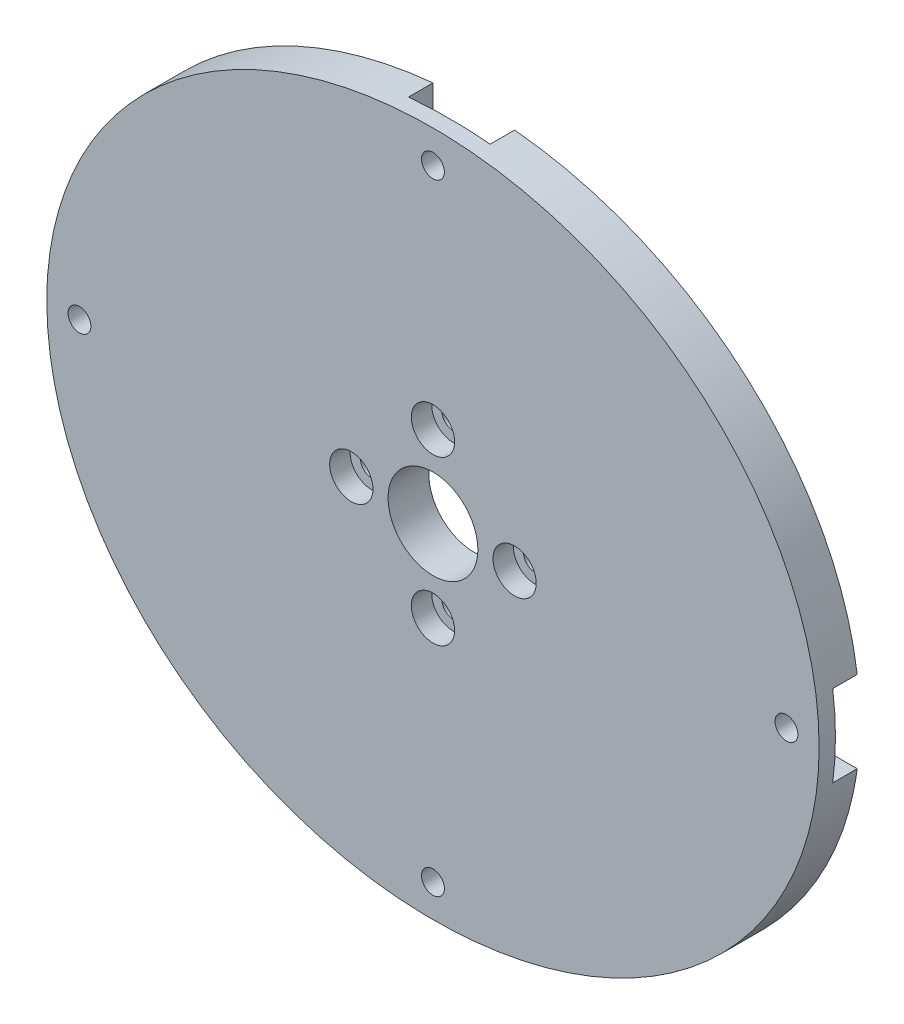
from build123d import *

# Parameters (mm, degrees)
SKETCH1_RX          = 47.3
SKETCH1_RY          = 42
SKETCH1_R           = 5.5
SKETCH1_R_2         = 1.4
BOSS_EXTRUDE1_DEPTH = 5
CUT_EXTRUDE3_START  = -2.5
SKETCH5_R           = 2.65
SKETCH5_R_2         = 1.4
CUT_EXTRUDE3_DEPTH  = 2.5
CUT_EXTRUDE4_DEPTH  = 3


with BuildPart() as part:
    # Sketch1 → Boss-Extrude1 (new body)
    with BuildSketch(Plane.XY):
        with Locations(Location((0, 0), (0, 0, 180))):
            Ellipse(SKETCH1_RX, SKETCH1_RY)
        Circle(SKETCH1_R, mode=Mode.SUBTRACT)
        with Locations((-10, 0)):
            Circle(SKETCH1_R_2, mode=Mode.SUBTRACT)
        with Locations((0, 10)):
            Circle(SKETCH1_R_2, mode=Mode.SUBTRACT)
        with Locations((10, 0)):
            Circle(SKETCH1_R_2, mode=Mode.SUBTRACT)
        with Locations((0, -10)):
            Circle(SKETCH1_R_2, mode=Mode.SUBTRACT)
        with Locations((0, 38)):
            Circle(SKETCH1_R_2, mode=Mode.SUBTRACT)
        with Locations((-43.3, 0)):
            Circle(SKETCH1_R_2, mode=Mode.SUBTRACT)
        with Locations((43.3, 0)):
            Circle(SKETCH1_R_2, mode=Mode.SUBTRACT)
        with Locations((0, -38)):
            Circle(SKETCH1_R_2, mode=Mode.SUBTRACT)
    extrude(amount=BOSS_EXTRUDE1_DEPTH)

    # Sketch5 → Cut-Extrude3 (cut)
    # profile 1 of 4: a face of its own
    with BuildSketch(Plane.XY.offset(5).offset(CUT_EXTRUDE3_START)):
        with Locations((0, 10)):
            Circle(SKETCH5_R)
        with Locations((0, 10)):
            Circle(SKETCH5_R_2, mode=Mode.SUBTRACT)
    # profile 2 of 4: a face of its own
    with BuildSketch(Plane.XY.offset(5).offset(CUT_EXTRUDE3_START)):
        with Locations((10, 0)):
            Circle(SKETCH5_R)
        with Locations((10, 0)):
            Circle(SKETCH5_R_2, mode=Mode.SUBTRACT)
    # profile 3 of 4: a face of its own
    with BuildSketch(Plane.XY.offset(5).offset(CUT_EXTRUDE3_START)):
        with Locations((0, -10)):
            Circle(SKETCH5_R)
        with Locations((0, -10)):
            Circle(SKETCH5_R_2, mode=Mode.SUBTRACT)
    # profile 4 of 4: a face of its own
    with BuildSketch(Plane.XY.offset(5).offset(CUT_EXTRUDE3_START)):
        with Locations((-10, 0)):
            Circle(SKETCH5_R)
        with Locations((-10, 0)):
            Circle(SKETCH5_R_2, mode=Mode.SUBTRACT)
    extrude(amount=CUT_EXTRUDE3_DEPTH, mode=Mode.SUBTRACT)

    # Sketch6 → Cut-Extrude4 (cut)
    with BuildSketch(Plane(origin=(0, 0, 0), x_dir=(-1, 0, 0), z_dir=(0, 0, -1))):
        with BuildLine():
            Line((-5, 41.764681883), (-5, 31.764681883))
            Line((-5, 31.764681883), (5, 31.764681883))
            Line((5, 31.764681883), (5, 41.764681883))
            add(Edge.make_bspline(
                [(5, 41.764681883), (0, 42.236643989), (-5, 41.764681883)],
                knots=[1.464890217, 1.464890217, 1.464890217, 1.676702437, 1.676702437, 1.676702437], degree=2, weights=[1, 0.994397188, 1]))
        make_face()
        with BuildLine():
            Line((-46.963628217, 5), (-36.963628217, 5))
            Line((-36.963628217, 5), (-36.963628217, -5))
            Line((-36.963628217, -5), (-46.963628217, -5))
            add(Edge.make_bspline(
                [(-46.963628217, 5), (-47.638781009, 0), (-46.963628217, -5)],
                knots=[3.022262029, 3.022262029, 3.022262029, 3.260923278, 3.260923278, 3.260923278], degree=2, weights=[1, 0.992888546, 1]))
        make_face()
        with BuildLine():
            Line((46.963628217, 5), (36.963628217, 5))
            Line((36.963628217, 5), (36.963628217, -5))
            Line((36.963628217, -5), (46.963628217, -5))
            add(Edge.make_bspline(
                [(46.963628217, -5), (47.638781009, 0), (46.963628217, 5)],
                knots=[3.022262029, 3.022262029, 3.022262029, 3.260923278, 3.260923278, 3.260923278], degree=2, weights=[1, 0.992888546, 1]))
        make_face()
        with BuildLine():
            Line((5, -31.764681883), (5, -41.764681883))
            add(Edge.make_bspline(
                [(-5, -41.764681883), (0, -42.236643989), (5, -41.764681883)],
                knots=[4.60648287, 4.60648287, 4.60648287, 4.81829509, 4.81829509, 4.81829509], degree=2, weights=[1, 0.994397188, 1]))
            Line((-5, -41.764681883), (-5, -31.764681883))
            Line((-5, -31.764681883), (5, -31.764681883))
        make_face()
    extrude(amount=-CUT_EXTRUDE4_DEPTH, mode=Mode.SUBTRACT)


solid = part.part
